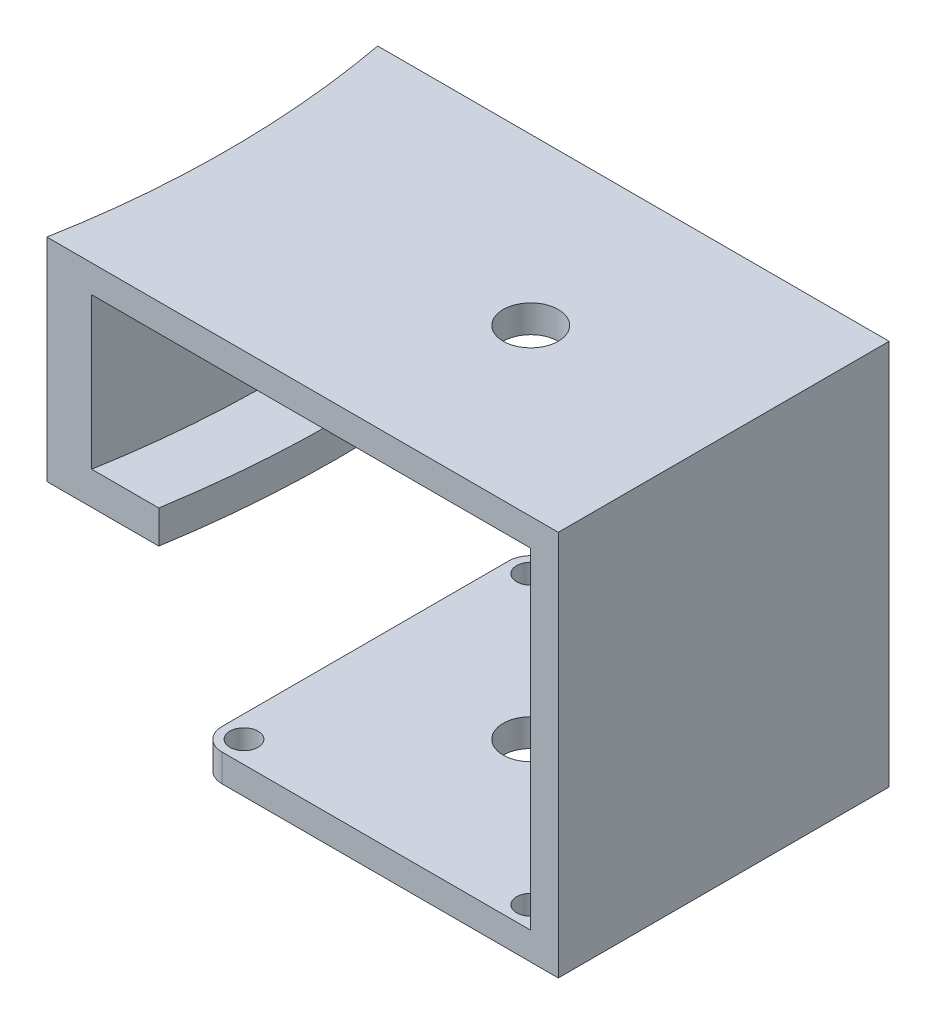
from build123d import *

# Parameters (mm, degrees)
SKETCH1_R           = 2.55
BOSS_EXTRUDE1_DEPTH = 5
SKETCH2_R           = 5
CUT_EXTRUDE1_DEPTH  = 10
SKETCH3_W           = 5
SKETCH3_H           = 60
BOSS_EXTRUDE2_DEPTH = 70
SKETCH4_W           = 80
SKETCH4_H           = 60
BOSS_EXTRUDE4_DEPTH = 5
SKETCH5_R           = 5
CUT_EXTRUDE3_DEPTH  = 5
BOSS_EXTRUDE6_DEPTH = 6
BOSS_EXTRUDE7_START = -32.4
BOSS_EXTRUDE7_DEPTH = 32.4


# Read off the part's stored shape, not the designer's step: Boss-Extrude7
with BuildPart() as part:
    # Sketch1 → Boss-Extrude1 (new body)
    with BuildSketch(Plane(origin=(0, 0, 0), x_dir=(1, 0, 0), z_dir=(0, 1, 0))):
        with BuildLine():
            Line((-26, -30), (30, -30))
            Line((30, -30), (30, 30))
            Line((30, 30), (-26, 30))
            ThreePointArc((-26, 30), (-28.828427125, 28.828427125), (-30, 26))
            Line((-30, 26), (-30, -26))
            ThreePointArc((-30, -26), (-28.828427125, -28.828427125), (-26, -30))
        make_face()
        with Locations(Location((26, 26, 0), (0, 0, 270))):
            Circle(SKETCH1_R, mode=Mode.SUBTRACT)
        with Locations(Location((-26, 26, 0), (0, 0, 270))):
            Circle(SKETCH1_R, mode=Mode.SUBTRACT)
        with Locations(Location((-26, -26, 0), (0, 0, 270))):
            Circle(SKETCH1_R, mode=Mode.SUBTRACT)
        with Locations(Location((26, -26, 0), (0, 0, 270))):
            Circle(SKETCH1_R, mode=Mode.SUBTRACT)
    extrude(amount=BOSS_EXTRUDE1_DEPTH)

    # Sketch2 → Cut-Extrude1 (cut)
    with BuildSketch(Plane(origin=(0, 5, 0), x_dir=(1, 0, 0), z_dir=(0, 1, 0))):
        with Locations(Location((0, 0, 0), (0, 0, 270))):
            Circle(SKETCH2_R)
    extrude(amount=-CUT_EXTRUDE1_DEPTH, mode=Mode.SUBTRACT)

    # Sketch3 → Boss-Extrude2 (add)
    with BuildSketch(Plane.XZ):
        with Locations((32.5, 0)):
            Rectangle(SKETCH3_W, SKETCH3_H)
    extrude(amount=-BOSS_EXTRUDE2_DEPTH)

    # Sketch4 → Boss-Extrude4 (add)
    with BuildSketch(Plane(origin=(0, 70, 0), x_dir=(1, 0, 0), z_dir=(0, 1, 0))):
        with Locations((-10, 0)):
            Rectangle(SKETCH4_W, SKETCH4_H)
    extrude(amount=-BOSS_EXTRUDE4_DEPTH)

    # Sketch5 → Cut-Extrude3 (cut)
    with BuildSketch(Plane(origin=(0, 70, 0), x_dir=(1, 0, 0), z_dir=(0, 1, 0))):
        with Locations(Location((0, 0, 0), (0, 0, 270))):
            Circle(SKETCH5_R)
    extrude(amount=-CUT_EXTRUDE3_DEPTH, mode=Mode.SUBTRACT)



with BuildPart() as body_2:
    # Sketch10 → Boss-Extrude6 (new body)
    with BuildSketch(Plane(origin=(0, 31.6, 0), x_dir=(1, 0, 0), z_dir=(0, 1, 0))):
        with BuildLine():
            Line((-37.448637365, -30), (-57.750192604, -30))
            ThreePointArc((-57.750192604, -30), (-55, 0), (-57.750192604, 30))
            Line((-57.750192604, 30), (-37.448637365, 30))
            ThreePointArc((-37.448637365, 30), (-35, 0), (-37.448637365, -30))
        make_face()
    extrude(amount=BOSS_EXTRUDE6_DEPTH)


with BuildPart() as part_1:
    add(part.part)

    add(body_2.part)  # Boss-Extrude7 merges body 2
    # Boss-Extrude7 outline → Boss-Extrude7 (add)
    with BuildSketch(Plane(origin=(0, 70, 0), x_dir=(1, 0, 0), z_dir=(0, 1, 0)).offset(BOSS_EXTRUDE7_START)):
        with BuildLine():
            ThreePointArc((-57.750192604, 30), (-55, 0), (-57.750192604, -30))
            Line((-57.750192604, -30), (-49.621010685, -30))
            ThreePointArc((-49.621010685, -30), (-47, 0), (-49.621010685, 30))
            Line((-49.621010685, 30), (-57.750192604, 30))
        make_face()
    extrude(amount=BOSS_EXTRUDE7_DEPTH)


solid = part_1.part
